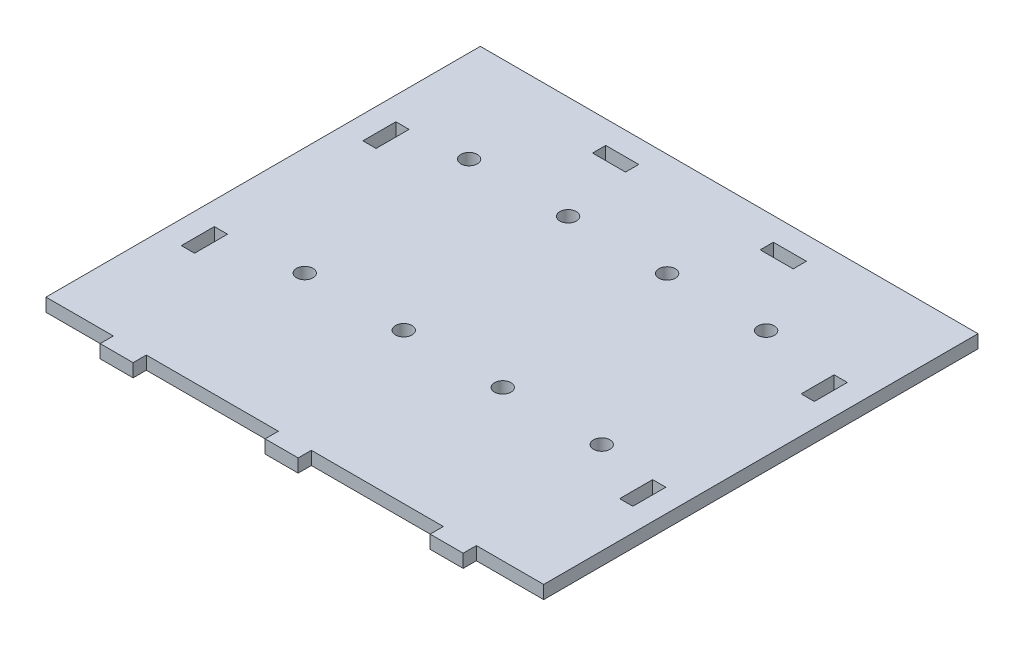
from build123d import *

# Parameters (mm, degrees)
SKETCH1_W               = 150.8
SKETCH1_H               = 131.6
BOSS_EXTRUDE1_DEPTH     = 4
F_5_0MM_DOWEL_HOLE1_D   = 5
F_5_0MM_DOWEL_HOLE2_D   = 5
CAVITY1_START           = -58.8
CAVITY1_OUTLINE_W       = 10
CAVITY1_OUTLINE_H       = 3.997862951
CAVITY1_DEPTH           = 4
CAVITY1_START_2         = -33.210330997
CAVITY1_2_OUTLINE_W     = 4
CAVITY1_2_OUTLINE_H     = 3.997862951
CAVITY1_2_DEPTH         = 10
CAVITY1_START_3         = 21.789669003
CAVITY1_3_OUTLINE_W     = 4
CAVITY1_3_OUTLINE_H     = 3.997862951
CAVITY1_3_DEPTH         = 10
CUT_EXTRUDE6_DEPTH      = 101.153796274
CUT_EXTRUDE6_DEPTH_BACK = 101.153796274
SKETCH14_W              = 4
SKETCH14_H              = 10
SKETCH14_W_2            = 10
SKETCH14_H_2            = 4
SKETCH15_W              = 10
SKETCH15_H              = 4
BOSS_EXTRUDE2_DEPTH     = 4


# Read off the part's stored shape, not the designer's step: Cavity1
with BuildPart() as part:
    # Sketch1 → Boss-Extrude1 (new body)
    with BuildSketch(Plane(origin=(0, 0, 0), x_dir=(1, 0, 0), z_dir=(0, 1, 0))):
        Rectangle(SKETCH1_W, SKETCH1_H)
    extrude(amount=BOSS_EXTRUDE1_DEPTH)

    # Ø5.0mm Dowel Hole1 (through all)
    with Locations(Plane(origin=(0, 4, 0), x_dir=(1, 0, 0), z_dir=(0, 1, 0))):
        with Locations((-42.5, -20.3)):
            Hole(F_5_0MM_DOWEL_HOLE1_D / 2)

    # Ø5.0mm Dowel Hole2 (through all)
    with Locations(Plane(origin=(0, 4, 0), x_dir=(1, 0, 0), z_dir=(0, 1, 0))):
        with Locations((-12.5, -20.3), (17.5, -20.3), (47.5, -20.3), (-47.5, 34.5), (-17.5, 34.5), (12.5, 34.5), (42.5, 34.5)):
            Hole(F_5_0MM_DOWEL_HOLE2_D / 2)

    # Cavity1 outline → Cavity1 (cut)
    with BuildSketch(Plane.XY.offset(CAVITY1_START)):
        with Locations((25.4, 2.001068524)):
            Rectangle(CAVITY1_OUTLINE_W, CAVITY1_OUTLINE_H)
        with Locations((-25.4, 2.001068524)):
            Rectangle(CAVITY1_OUTLINE_W, CAVITY1_OUTLINE_H)
    extrude(amount=CAVITY1_DEPTH, mode=Mode.SUBTRACT)

    # Cavity1 2 outline → Cavity1 2 (cut)
    with BuildSketch(Plane.XY.offset(CAVITY1_START_2)):
        with Locations((-66.4, 2.001068524)):
            Rectangle(CAVITY1_2_OUTLINE_W, CAVITY1_2_OUTLINE_H)
        with Locations((66.4, 2.001068524)):
            Rectangle(CAVITY1_2_OUTLINE_W, CAVITY1_2_OUTLINE_H)
    extrude(amount=CAVITY1_2_DEPTH, mode=Mode.SUBTRACT)

    # Cavity1 3 outline → Cavity1 3 (cut)
    with BuildSketch(Plane.XY.offset(CAVITY1_START_3)):
        with Locations((-66.4, 2.001068524)):
            Rectangle(CAVITY1_3_OUTLINE_W, CAVITY1_3_OUTLINE_H)
        with Locations((66.4, 2.001068524)):
            Rectangle(CAVITY1_3_OUTLINE_W, CAVITY1_3_OUTLINE_H)
    extrude(amount=CAVITY1_3_DEPTH, mode=Mode.SUBTRACT)

    # Sketch14 → Cut-Extrude6 (cut, two sides: drawn at the far end of the back side and taken through both)
    with BuildSketch(Plane(origin=(0, 0.002137049, 0), x_dir=(1, 0, 0), z_dir=(0, 1, 0)).offset(-CUT_EXTRUDE6_DEPTH_BACK)):
        with Locations((-66.4, -26.789669003)):
            Rectangle(SKETCH14_W, SKETCH14_H)
        with Locations((-66.4, 28.210330997)):
            Rectangle(SKETCH14_W, SKETCH14_H)
        with Locations((25.4, 56.8)):
            Rectangle(SKETCH14_W_2, SKETCH14_H_2)
        with Locations((-25.4, 56.8)):
            Rectangle(SKETCH14_W_2, SKETCH14_H_2)
        with Locations((66.4, 28.210330997)):
            Rectangle(SKETCH14_W, SKETCH14_H)
        with Locations((66.4, -26.789669003)):
            Rectangle(SKETCH14_W, SKETCH14_H)
    extrude(amount=CUT_EXTRUDE6_DEPTH + CUT_EXTRUDE6_DEPTH_BACK, mode=Mode.SUBTRACT)

    # Sketch15 → Boss-Extrude2 (add)
    with BuildSketch(Plane.XY.offset(65.8)):
        with Locations((-50, 2)):
            Rectangle(SKETCH15_W, SKETCH15_H)
        with Locations((0, 2)):
            Rectangle(SKETCH15_W, SKETCH15_H)
        with Locations((50, 2)):
            Rectangle(SKETCH15_W, SKETCH15_H)
    extrude(amount=BOSS_EXTRUDE2_DEPTH)


solid = part.part
